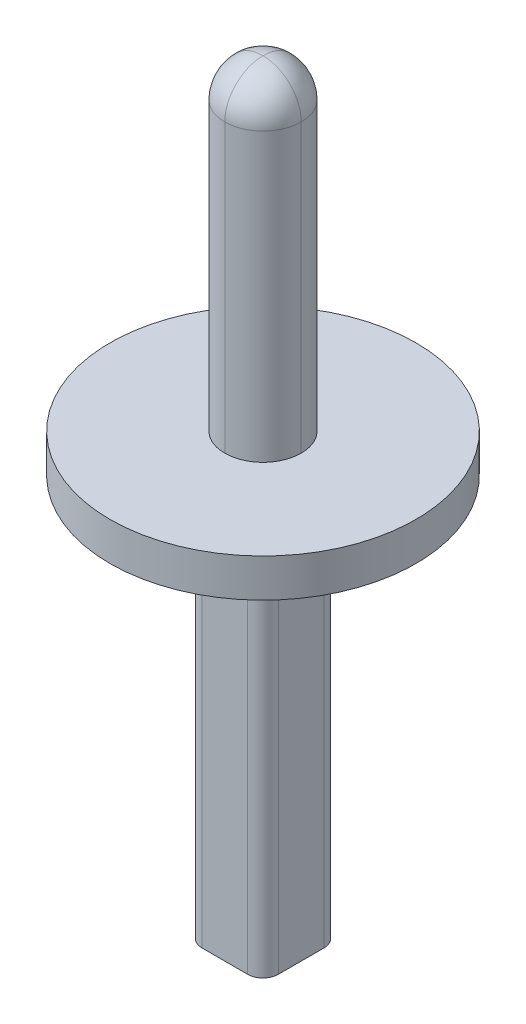
from build123d import *

# Parameters (mm, degrees)
SKETCH1_W           = 10
SKETCH1_H           = 10
BOSS_EXTRUDE1_DEPTH = 50
BOSS_EXTRUDE2_START = -45
SKETCH2_R           = 20
BOSS_EXTRUDE2_DEPTH = 2.5
FILLET2_R           = 2
FILLET3_R           = 5
FILLET4_R           = 5


with BuildPart() as part:
    # Sketch1 → Boss-Extrude1 (new, symmetric)
    with BuildSketch(Plane(origin=(0, 0, 0), x_dir=(1, 0, 0), z_dir=(0, 1, 0))):
        Rectangle(SKETCH1_W, SKETCH1_H)
    extrude(amount=BOSS_EXTRUDE1_DEPTH, both=True)

    # Sketch2 → Boss-Extrude2 (add, symmetric)
    with BuildSketch(Plane(origin=(0, 50, 0), x_dir=(1, 0, 0), z_dir=(0, 1, 0)).offset(BOSS_EXTRUDE2_START)):
        with Locations(Location((0, 0, 0), (0, 0, 270))):
            Circle(SKETCH2_R)
    extrude(amount=BOSS_EXTRUDE2_DEPTH, both=True)

    # Fillet2
    fillet2_edges = [part.edges().sort_by_distance(p)[0] for p in [
        (5, -23.75, 5),
        (-5, -23.75, 5),
        (-5, -23.75, -5),
        (5, -23.75, -5),
    ]]
    fillet(fillet2_edges, radius=FILLET2_R)

    # Fillet3
    fillet3_edges = [part.edges().sort_by_distance(p)[0] for p in [
        (-5, 28.75, -5),
        (-5, 28.75, 5),
        (5, 28.75, 5),
        (5, 28.75, -5),
    ]]
    fillet(fillet3_edges, radius=FILLET3_R - 0.0001)  # a hair under: the kernel refuses the full size

    # Fillet4
    fillet4_edges = [part.edges().sort_by_distance(p)[0] for p in [
        (3.535563195, 50, -3.535563195),
        (3.535563195, 50, 3.535563195),
        (-3.535563195, 50, 3.535563195),
        (-3.535563195, 50, -3.535563195),
    ]]
    fillet(fillet4_edges, radius=FILLET4_R - 0.0001)  # a hair under: the kernel refuses the full size


solid = part.part
